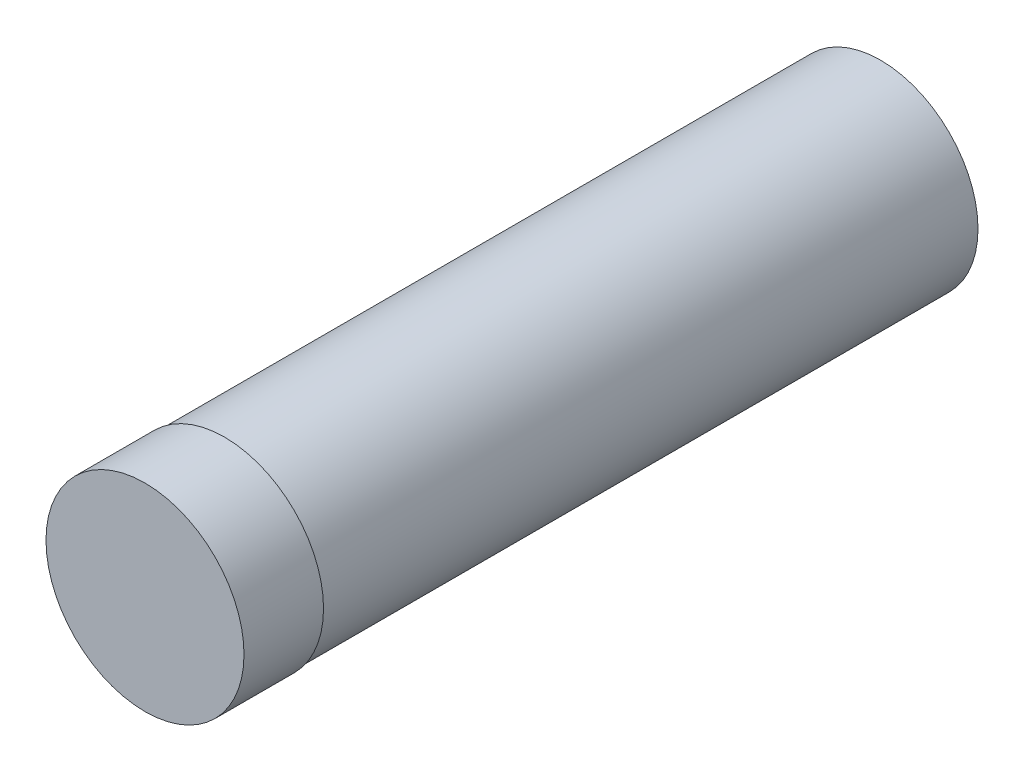
from build123d import *

# Parameters (mm, degrees)
SKETCH1_R           = 2.45
BOSS_EXTRUDE1_DEPTH = 9.25
SKETCH3_R           = 2.49
BOSS_EXTRUDE2_DEPTH = 2


with BuildPart() as part:
    # Sketch1 → Boss-Extrude1 (new, symmetric)
    with BuildSketch(Plane.XY):
        Circle(SKETCH1_R)
    extrude(amount=BOSS_EXTRUDE1_DEPTH, both=True)

    # Sketch3 → Boss-Extrude2 (add)
    with BuildSketch(Plane.XY.offset(9.25)):
        Circle(SKETCH3_R)
    extrude(amount=-BOSS_EXTRUDE2_DEPTH)


solid = part.part
